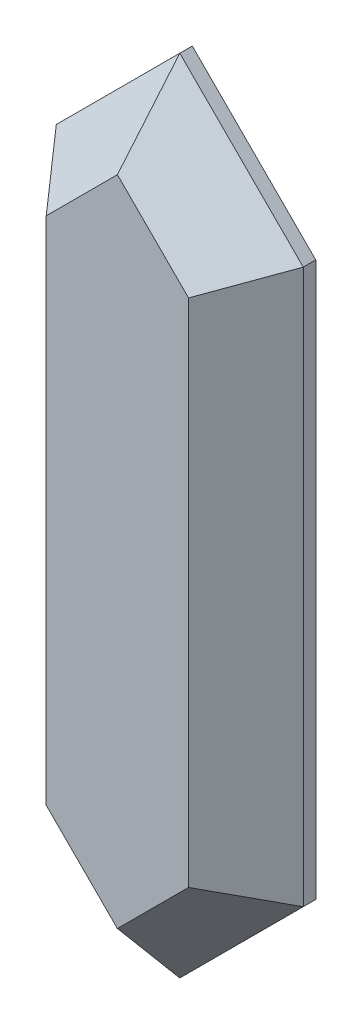
from build123d import *

# Parameters (mm, degrees)
EXTRUDE_1_DEPTH     = 2
EXTRUDE_2_DEPTH     = 10
EXTRUDE_2_TAPER     = 40
CUT_EXTRUDE_1_DEPTH = 2
CUT_EXTRUDE_2_DEPTH = 7
CUT_EXTRUDE_2_DRAFT = -40
EXTRUDE_4_DEPTH     = 0.7
EXTRUDE_4_TAPER     = 45


with BuildPart() as part:
    # Skizze1 → Бобышка-Вытянуть1 (new body)
    with BuildSketch(Plane.XY):
        Polygon((-19.798989873, 44.3), (0, 64.098989873), (19.798989873, 44.3), (19.798989873, -44.5), (0, -64.298989873), (-19.798989873, -44.5), align=None)
    extrude(amount=EXTRUDE_1_DEPTH)

    # Эскиз1 → Бобышка-Вытянуть2 (add)
    with BuildSketch(Plane.XY.offset(2)):
        Polygon((-19.798989873, 44.3), (-19.798989873, -44.5), (0, -64.298989873), (19.798989873, -44.5), (19.798989873, 44.3), (0, 64.098989873), align=None)
    extrude(amount=EXTRUDE_2_DEPTH, taper=EXTRUDE_2_TAPER)

    # Эскиз2 → Вырез-Вытянуть1 (cut)
    with BuildSketch(Plane(origin=(0, 0, 0), x_dir=(-1, 0, 0), z_dir=(0, 0, -1))):
        Polygon((-17.998989873, 43.554415588), (0, 61.553405461), (17.998989873, 43.554415588), (17.998989873, -43.754415588), (0, -61.753405461), (-17.998989873, -43.754415588), align=None)
    extrude(amount=-CUT_EXTRUDE_1_DEPTH, mode=Mode.SUBTRACT)


with BuildPart() as cut_extrude_2_tool:
    # Эскиз3 → Вырез-Вытянуть2 (with draft: the straight prism first)
    with BuildSketch(Plane(origin=(0, 0, 2), x_dir=(-1, 0, 0), z_dir=(0, 0, -1))):
        Polygon((-17.998989873, 43.554415588), (-17.998989873, -43.754415588), (0, -61.753405461), (17.998989873, -43.754415588), (17.998989873, 43.554415588), (0, 61.553405461), align=None)
    extrude(amount=-CUT_EXTRUDE_2_DEPTH)
    # Вырез-Вытянуть2: the draft: its side faces are tilted about the plane it starts from
    cut_extrude_2_sides = [cut_extrude_2_tool.faces().sort_by_distance(p)[0] for p in [
        (17.998989873, -0.1, 5.5),
        (8.999494937, -52.753910524, 5.5),
        (-8.999494937, -52.753910524, 5.5),
        (-17.998989873, -0.1, 5.5),
        (-8.999494937, 52.553910524, 5.5),
        (8.999494937, 52.553910524, 5.5),
    ]]
    draft(cut_extrude_2_sides, Plane(origin=(0, 0, 2), x_dir=(-1, 0, 0), z_dir=(0, 0, -1)), CUT_EXTRUDE_2_DRAFT)


with BuildPart() as part_1:
    add(part.part)

    # Вырез-Вытянуть2: cut by cut_extrude_2_tool
    add(cut_extrude_2_tool.part, mode=Mode.SUBTRACT)

    # Эскиз4 → Бобышка-Вытянуть4 (add)
    with BuildSketch(Plane(origin=(0, 0, 9), x_dir=(-1, 0, 0), z_dir=(0, 0, -1))):
        Polygon((-0.662531934, 48.870219551), (-1.749476442, 49.468949375), (-2.811463933, 48.826992731), (-2.786506916, 47.586306263), (-1.699562408, 46.987576439), (-0.637574917, 47.629533083), align=None)
        Polygon((2.787468066, 48.870219551), (1.700523558, 49.468949375), (0.638536067, 48.826992731), (0.663493084, 47.586306263), (1.750437592, 46.987576439), (2.812425083, 47.629533083), align=None)
        Polygon((-4.112531934, 44.870219551), (-5.199476442, 45.468949375), (-6.261463933, 44.826992731), (-6.236506916, 43.586306263), (-5.149562408, 42.987576439), (-4.087574917, 43.629533083), align=None)
        Polygon((-0.662531934, 44.870219551), (-1.749476442, 45.468949375), (-2.811463933, 44.826992731), (-2.786506916, 43.586306263), (-1.699562408, 42.987576439), (-0.637574917, 43.629533083), align=None)
        Polygon((2.787468066, 44.870219551), (1.700523558, 45.468949375), (0.638536067, 44.826992731), (0.663493084, 43.586306263), (1.750437592, 42.987576439), (2.812425083, 43.629533083), align=None)
        Polygon((6.237468066, 44.870219551), (5.150523558, 45.468949375), (4.088536067, 44.826992731), (4.113493084, 43.586306263), (5.200437592, 42.987576439), (6.262425083, 43.629533083), align=None)
        Polygon((-4.112531934, 40.870219551), (-5.199476442, 41.468949375), (-6.261463933, 40.826992731), (-6.236506916, 39.586306263), (-5.149562408, 38.987576439), (-4.087574917, 39.629533083), align=None)
        Polygon((-0.662531934, 40.870219551), (-1.749476442, 41.468949375), (-2.811463933, 40.826992731), (-2.786506916, 39.586306263), (-1.699562408, 38.987576439), (-0.637574917, 39.629533083), align=None)
        Polygon((2.787468066, 40.870219551), (1.700523558, 41.468949375), (0.638536067, 40.826992731), (0.663493084, 39.586306263), (1.750437592, 38.987576439), (2.812425083, 39.629533083), align=None)
        Polygon((6.237468066, 40.870219551), (5.150523558, 41.468949375), (4.088536067, 40.826992731), (4.113493084, 39.586306263), (5.200437592, 38.987576439), (6.262425083, 39.629533083), align=None)
        Polygon((9.687468066, 40.870219551), (8.600523558, 41.468949375), (7.538536067, 40.826992731), (7.563493084, 39.586306263), (8.650437592, 38.987576439), (9.712425083, 39.629533083), align=None)
        Polygon((-4.112531934, 36.870219551), (-5.199476442, 37.468949375), (-6.261463933, 36.826992731), (-6.236506916, 35.586306263), (-5.149562408, 34.987576439), (-4.087574917, 35.629533083), align=None)
        Polygon((-0.662531934, 36.870219551), (-1.749476442, 37.468949375), (-2.811463933, 36.826992731), (-2.786506916, 35.586306263), (-1.699562408, 34.987576439), (-0.637574917, 35.629533083), align=None)
        Polygon((2.787468066, 36.870219551), (1.700523558, 37.468949375), (0.638536067, 36.826992731), (0.663493084, 35.586306263), (1.750437592, 34.987576439), (2.812425083, 35.629533083), align=None)
        Polygon((6.237468066, 36.870219551), (5.150523558, 37.468949375), (4.088536067, 36.826992731), (4.113493084, 35.586306263), (5.200437592, 34.987576439), (6.262425083, 35.629533083), align=None)
        Polygon((9.687468066, 36.870219551), (8.600523558, 37.468949375), (7.538536067, 36.826992731), (7.563493084, 35.586306263), (8.650437592, 34.987576439), (9.712425083, 35.629533083), align=None)
        Polygon((-4.112531934, 32.870219551), (-5.199476442, 33.468949375), (-6.261463933, 32.826992731), (-6.236506916, 31.586306263), (-5.149562408, 30.987576439), (-4.087574917, 31.629533083), align=None)
        Polygon((-0.662531934, 32.870219551), (-1.749476442, 33.468949375), (-2.811463933, 32.826992731), (-2.786506916, 31.586306263), (-1.699562408, 30.987576439), (-0.637574917, 31.629533083), align=None)
        Polygon((2.787468066, 32.870219551), (1.700523558, 33.468949375), (0.638536067, 32.826992731), (0.663493084, 31.586306263), (1.750437592, 30.987576439), (2.812425083, 31.629533083), align=None)
        Polygon((6.237468066, 32.870219551), (5.150523558, 33.468949375), (4.088536067, 32.826992731), (4.113493084, 31.586306263), (5.200437592, 30.987576439), (6.262425083, 31.629533083), align=None)
        Polygon((9.687468066, 32.870219551), (8.600523558, 33.468949375), (7.538536067, 32.826992731), (7.563493084, 31.586306263), (8.650437592, 30.987576439), (9.712425083, 31.629533083), align=None)
        Polygon((-4.112531934, 28.870219551), (-5.199476442, 29.468949375), (-6.261463933, 28.826992731), (-6.236506916, 27.586306263), (-5.149562408, 26.987576439), (-4.087574917, 27.629533083), align=None)
        Polygon((-0.662531934, 28.870219551), (-1.749476442, 29.468949375), (-2.811463933, 28.826992731), (-2.786506916, 27.586306263), (-1.699562408, 26.987576439), (-0.637574917, 27.629533083), align=None)
        Polygon((2.787468066, 28.870219551), (1.700523558, 29.468949375), (0.638536067, 28.826992731), (0.663493084, 27.586306263), (1.750437592, 26.987576439), (2.812425083, 27.629533083), align=None)
        Polygon((6.237468066, 28.870219551), (5.150523558, 29.468949375), (4.088536067, 28.826992731), (4.113493084, 27.586306263), (5.200437592, 26.987576439), (6.262425083, 27.629533083), align=None)
        Polygon((9.687468066, 28.870219551), (8.600523558, 29.468949375), (7.538536067, 28.826992731), (7.563493084, 27.586306263), (8.650437592, 26.987576439), (9.712425083, 27.629533083), align=None)
        Polygon((-4.112531934, 24.870219551), (-5.199476442, 25.468949375), (-6.261463933, 24.826992731), (-6.236506916, 23.586306263), (-5.149562408, 22.987576439), (-4.087574917, 23.629533083), align=None)
        Polygon((-0.662531934, 24.870219551), (-1.749476442, 25.468949375), (-2.811463933, 24.826992731), (-2.786506916, 23.586306263), (-1.699562408, 22.987576439), (-0.637574917, 23.629533083), align=None)
        Polygon((2.787468066, 24.870219551), (1.700523558, 25.468949375), (0.638536067, 24.826992731), (0.663493084, 23.586306263), (1.750437592, 22.987576439), (2.812425083, 23.629533083), align=None)
        Polygon((6.237468066, 24.870219551), (5.150523558, 25.468949375), (4.088536067, 24.826992731), (4.113493084, 23.586306263), (5.200437592, 22.987576439), (6.262425083, 23.629533083), align=None)
        Polygon((9.687468066, 24.870219551), (8.600523558, 25.468949375), (7.538536067, 24.826992731), (7.563493084, 23.586306263), (8.650437592, 22.987576439), (9.712425083, 23.629533083), align=None)
        Polygon((-4.112531934, 20.870219551), (-5.199476442, 21.468949375), (-6.261463933, 20.826992731), (-6.236506916, 19.586306263), (-5.149562408, 18.987576439), (-4.087574917, 19.629533083), align=None)
        Polygon((-0.662531934, 20.870219551), (-1.749476442, 21.468949375), (-2.811463933, 20.826992731), (-2.786506916, 19.586306263), (-1.699562408, 18.987576439), (-0.637574917, 19.629533083), align=None)
        Polygon((2.787468066, 20.870219551), (1.700523558, 21.468949375), (0.638536067, 20.826992731), (0.663493084, 19.586306263), (1.750437592, 18.987576439), (2.812425083, 19.629533083), align=None)
        Polygon((6.237468066, 20.870219551), (5.150523558, 21.468949375), (4.088536067, 20.826992731), (4.113493084, 19.586306263), (5.200437592, 18.987576439), (6.262425083, 19.629533083), align=None)
        Polygon((9.687468066, 20.870219551), (8.600523558, 21.468949375), (7.538536067, 20.826992731), (7.563493084, 19.586306263), (8.650437592, 18.987576439), (9.712425083, 19.629533083), align=None)
        Polygon((-4.112531934, 16.870219551), (-5.199476442, 17.468949375), (-6.261463933, 16.826992731), (-6.236506916, 15.586306263), (-5.149562408, 14.987576439), (-4.087574917, 15.629533083), align=None)
        Polygon((-0.662531934, 16.870219551), (-1.749476442, 17.468949375), (-2.811463933, 16.826992731), (-2.786506916, 15.586306263), (-1.699562408, 14.987576439), (-0.637574917, 15.629533083), align=None)
        Polygon((2.787468066, 16.870219551), (1.700523558, 17.468949375), (0.638536067, 16.826992731), (0.663493084, 15.586306263), (1.750437592, 14.987576439), (2.812425083, 15.629533083), align=None)
        Polygon((6.237468066, 16.870219551), (5.150523558, 17.468949375), (4.088536067, 16.826992731), (4.113493084, 15.586306263), (5.200437592, 14.987576439), (6.262425083, 15.629533083), align=None)
        Polygon((9.687468066, 16.870219551), (8.600523558, 17.468949375), (7.538536067, 16.826992731), (7.563493084, 15.586306263), (8.650437592, 14.987576439), (9.712425083, 15.629533083), align=None)
        Polygon((-4.112531934, 12.870219551), (-5.199476442, 13.468949375), (-6.261463933, 12.826992731), (-6.236506916, 11.586306263), (-5.149562408, 10.987576439), (-4.087574917, 11.629533083), align=None)
        Polygon((-0.662531934, 12.870219551), (-1.749476442, 13.468949375), (-2.811463933, 12.826992731), (-2.786506916, 11.586306263), (-1.699562408, 10.987576439), (-0.637574917, 11.629533083), align=None)
        Polygon((2.787468066, 12.870219551), (1.700523558, 13.468949375), (0.638536067, 12.826992731), (0.663493084, 11.586306263), (1.750437592, 10.987576439), (2.812425083, 11.629533083), align=None)
        Polygon((6.237468066, 12.870219551), (5.150523558, 13.468949375), (4.088536067, 12.826992731), (4.113493084, 11.586306263), (5.200437592, 10.987576439), (6.262425083, 11.629533083), align=None)
        Polygon((9.687468066, 12.870219551), (8.600523558, 13.468949375), (7.538536067, 12.826992731), (7.563493084, 11.586306263), (8.650437592, 10.987576439), (9.712425083, 11.629533083), align=None)
        Polygon((-4.112531934, 8.870219551), (-5.199476442, 9.468949375), (-6.261463933, 8.826992731), (-6.236506916, 7.586306263), (-5.149562408, 6.987576439), (-4.087574917, 7.629533083), align=None)
        Polygon((-0.662531934, 8.870219551), (-1.749476442, 9.468949375), (-2.811463933, 8.826992731), (-2.786506916, 7.586306263), (-1.699562408, 6.987576439), (-0.637574917, 7.629533083), align=None)
        Polygon((2.787468066, 8.870219551), (1.700523558, 9.468949375), (0.638536067, 8.826992731), (0.663493084, 7.586306263), (1.750437592, 6.987576439), (2.812425083, 7.629533083), align=None)
        Polygon((6.237468066, 8.870219551), (5.150523558, 9.468949375), (4.088536067, 8.826992731), (4.113493084, 7.586306263), (5.200437592, 6.987576439), (6.262425083, 7.629533083), align=None)
        Polygon((9.687468066, 8.870219551), (8.600523558, 9.468949375), (7.538536067, 8.826992731), (7.563493084, 7.586306263), (8.650437592, 6.987576439), (9.712425083, 7.629533083), align=None)
        Polygon((-4.112531934, 4.870219551), (-5.199476442, 5.468949375), (-6.261463933, 4.826992731), (-6.236506916, 3.586306263), (-5.149562408, 2.987576439), (-4.087574917, 3.629533083), align=None)
        Polygon((-0.662531934, 4.870219551), (-1.749476442, 5.468949375), (-2.811463933, 4.826992731), (-2.786506916, 3.586306263), (-1.699562408, 2.987576439), (-0.637574917, 3.629533083), align=None)
        Polygon((2.787468066, 4.870219551), (1.700523558, 5.468949375), (0.638536067, 4.826992731), (0.663493084, 3.586306263), (1.750437592, 2.987576439), (2.812425083, 3.629533083), align=None)
        Polygon((6.237468066, 4.870219551), (5.150523558, 5.468949375), (4.088536067, 4.826992731), (4.113493084, 3.586306263), (5.200437592, 2.987576439), (6.262425083, 3.629533083), align=None)
        Polygon((9.687468066, 4.870219551), (8.600523558, 5.468949375), (7.538536067, 4.826992731), (7.563493084, 3.586306263), (8.650437592, 2.987576439), (9.712425083, 3.629533083), align=None)
        Polygon((-4.112531934, 0.870219551), (-5.199476442, 1.468949375), (-6.261463933, 0.826992731), (-6.236506916, -0.413693737), (-5.149562408, -1.012423561), (-4.087574917, -0.370466917), align=None)
        Polygon((-0.662531934, 0.870219551), (-1.749476442, 1.468949375), (-2.811463933, 0.826992731), (-2.786506916, -0.413693737), (-1.699562408, -1.012423561), (-0.637574917, -0.370466917), align=None)
        Polygon((2.787468066, 0.870219551), (1.700523558, 1.468949375), (0.638536067, 0.826992731), (0.663493084, -0.413693737), (1.750437592, -1.012423561), (2.812425083, -0.370466917), align=None)
        Polygon((6.237468066, 0.870219551), (5.150523558, 1.468949375), (4.088536067, 0.826992731), (4.113493084, -0.413693737), (5.200437592, -1.012423561), (6.262425083, -0.370466917), align=None)
        Polygon((9.687468066, 0.870219551), (8.600523558, 1.468949375), (7.538536067, 0.826992731), (7.563493084, -0.413693737), (8.650437592, -1.012423561), (9.712425083, -0.370466917), align=None)
        Polygon((-4.112531934, -3.129780449), (-5.199476442, -2.531050625), (-6.261463933, -3.173007269), (-6.236506916, -4.413693737), (-5.149562408, -5.012423561), (-4.087574917, -4.370466917), align=None)
        Polygon((-0.662531934, -3.129780449), (-1.749476442, -2.531050625), (-2.811463933, -3.173007269), (-2.786506916, -4.413693737), (-1.699562408, -5.012423561), (-0.637574917, -4.370466917), align=None)
        Polygon((2.787468066, -3.129780449), (1.700523558, -2.531050625), (0.638536067, -3.173007269), (0.663493084, -4.413693737), (1.750437592, -5.012423561), (2.812425083, -4.370466917), align=None)
        Polygon((6.237468066, -3.129780449), (5.150523558, -2.531050625), (4.088536067, -3.173007269), (4.113493084, -4.413693737), (5.200437592, -5.012423561), (6.262425083, -4.370466917), align=None)
        Polygon((9.687468066, -3.129780449), (8.600523558, -2.531050625), (7.538536067, -3.173007269), (7.563493084, -4.413693737), (8.650437592, -5.012423561), (9.712425083, -4.370466917), align=None)
        Polygon((-4.112531934, -7.129780449), (-5.199476442, -6.531050625), (-6.261463933, -7.173007269), (-6.236506916, -8.413693737), (-5.149562408, -9.012423561), (-4.087574917, -8.370466917), align=None)
        Polygon((-0.662531934, -7.129780449), (-1.749476442, -6.531050625), (-2.811463933, -7.173007269), (-2.786506916, -8.413693737), (-1.699562408, -9.012423561), (-0.637574917, -8.370466917), align=None)
        Polygon((2.787468066, -7.129780449), (1.700523558, -6.531050625), (0.638536067, -7.173007269), (0.663493084, -8.413693737), (1.750437592, -9.012423561), (2.812425083, -8.370466917), align=None)
        Polygon((6.237468066, -7.129780449), (5.150523558, -6.531050625), (4.088536067, -7.173007269), (4.113493084, -8.413693737), (5.200437592, -9.012423561), (6.262425083, -8.370466917), align=None)
        Polygon((9.687468066, -7.129780449), (8.600523558, -6.531050625), (7.538536067, -7.173007269), (7.563493084, -8.413693737), (8.650437592, -9.012423561), (9.712425083, -8.370466917), align=None)
        Polygon((-4.112531934, -11.129780449), (-5.199476442, -10.531050625), (-6.261463933, -11.173007269), (-6.236506916, -12.413693737), (-5.149562408, -13.012423561), (-4.087574917, -12.370466917), align=None)
        Polygon((-0.662531934, -11.129780449), (-1.749476442, -10.531050625), (-2.811463933, -11.173007269), (-2.786506916, -12.413693737), (-1.699562408, -13.012423561), (-0.637574917, -12.370466917), align=None)
        Polygon((2.787468066, -11.129780449), (1.700523558, -10.531050625), (0.638536067, -11.173007269), (0.663493084, -12.413693737), (1.750437592, -13.012423561), (2.812425083, -12.370466917), align=None)
        Polygon((6.237468066, -11.129780449), (5.150523558, -10.531050625), (4.088536067, -11.173007269), (4.113493084, -12.413693737), (5.200437592, -13.012423561), (6.262425083, -12.370466917), align=None)
        Polygon((9.687468066, -11.129780449), (8.600523558, -10.531050625), (7.538536067, -11.173007269), (7.563493084, -12.413693737), (8.650437592, -13.012423561), (9.712425083, -12.370466917), align=None)
        Polygon((-4.112531934, -15.129780449), (-5.199476442, -14.531050625), (-6.261463933, -15.173007269), (-6.236506916, -16.413693737), (-5.149562408, -17.012423561), (-4.087574917, -16.370466917), align=None)
        Polygon((-0.662531934, -15.129780449), (-1.749476442, -14.531050625), (-2.811463933, -15.173007269), (-2.786506916, -16.413693737), (-1.699562408, -17.012423561), (-0.637574917, -16.370466917), align=None)
        Polygon((2.787468066, -15.129780449), (1.700523558, -14.531050625), (0.638536067, -15.173007269), (0.663493084, -16.413693737), (1.750437592, -17.012423561), (2.812425083, -16.370466917), align=None)
        Polygon((6.237468066, -15.129780449), (5.150523558, -14.531050625), (4.088536067, -15.173007269), (4.113493084, -16.413693737), (5.200437592, -17.012423561), (6.262425083, -16.370466917), align=None)
        Polygon((9.687468066, -15.129780449), (8.600523558, -14.531050625), (7.538536067, -15.173007269), (7.563493084, -16.413693737), (8.650437592, -17.012423561), (9.712425083, -16.370466917), align=None)
        Polygon((-4.112531934, -19.129780449), (-5.199476442, -18.531050625), (-6.261463933, -19.173007269), (-6.236506916, -20.413693737), (-5.149562408, -21.012423561), (-4.087574917, -20.370466917), align=None)
        Polygon((-0.662531934, -19.129780449), (-1.749476442, -18.531050625), (-2.811463933, -19.173007269), (-2.786506916, -20.413693737), (-1.699562408, -21.012423561), (-0.637574917, -20.370466917), align=None)
        Polygon((2.787468066, -19.129780449), (1.700523558, -18.531050625), (0.638536067, -19.173007269), (0.663493084, -20.413693737), (1.750437592, -21.012423561), (2.812425083, -20.370466917), align=None)
        Polygon((6.237468066, -19.129780449), (5.150523558, -18.531050625), (4.088536067, -19.173007269), (4.113493084, -20.413693737), (5.200437592, -21.012423561), (6.262425083, -20.370466917), align=None)
        Polygon((9.687468066, -19.129780449), (8.600523558, -18.531050625), (7.538536067, -19.173007269), (7.563493084, -20.413693737), (8.650437592, -21.012423561), (9.712425083, -20.370466917), align=None)
        Polygon((-4.112531934, -23.129780449), (-5.199476442, -22.531050625), (-6.261463933, -23.173007269), (-6.236506916, -24.413693737), (-5.149562408, -25.012423561), (-4.087574917, -24.370466917), align=None)
        Polygon((-0.662531934, -23.129780449), (-1.749476442, -22.531050625), (-2.811463933, -23.173007269), (-2.786506916, -24.413693737), (-1.699562408, -25.012423561), (-0.637574917, -24.370466917), align=None)
        Polygon((2.787468066, -23.129780449), (1.700523558, -22.531050625), (0.638536067, -23.173007269), (0.663493084, -24.413693737), (1.750437592, -25.012423561), (2.812425083, -24.370466917), align=None)
        Polygon((6.237468066, -23.129780449), (5.150523558, -22.531050625), (4.088536067, -23.173007269), (4.113493084, -24.413693737), (5.200437592, -25.012423561), (6.262425083, -24.370466917), align=None)
        Polygon((9.687468066, -23.129780449), (8.600523558, -22.531050625), (7.538536067, -23.173007269), (7.563493084, -24.413693737), (8.650437592, -25.012423561), (9.712425083, -24.370466917), align=None)
        Polygon((-4.112531934, -27.129780449), (-5.199476442, -26.531050625), (-6.261463933, -27.173007269), (-6.236506916, -28.413693737), (-5.149562408, -29.012423561), (-4.087574917, -28.370466917), align=None)
        Polygon((-0.662531934, -27.129780449), (-1.749476442, -26.531050625), (-2.811463933, -27.173007269), (-2.786506916, -28.413693737), (-1.699562408, -29.012423561), (-0.637574917, -28.370466917), align=None)
        Polygon((2.787468066, -27.129780449), (1.700523558, -26.531050625), (0.638536067, -27.173007269), (0.663493084, -28.413693737), (1.750437592, -29.012423561), (2.812425083, -28.370466917), align=None)
        Polygon((6.237468066, -27.129780449), (5.150523558, -26.531050625), (4.088536067, -27.173007269), (4.113493084, -28.413693737), (5.200437592, -29.012423561), (6.262425083, -28.370466917), align=None)
        Polygon((9.687468066, -27.129780449), (8.600523558, -26.531050625), (7.538536067, -27.173007269), (7.563493084, -28.413693737), (8.650437592, -29.012423561), (9.712425083, -28.370466917), align=None)
        Polygon((-4.112531934, -31.129780449), (-5.199476442, -30.531050625), (-6.261463933, -31.173007269), (-6.236506916, -32.413693737), (-5.149562408, -33.012423561), (-4.087574917, -32.370466917), align=None)
        Polygon((-0.662531934, -31.129780449), (-1.749476442, -30.531050625), (-2.811463933, -31.173007269), (-2.786506916, -32.413693737), (-1.699562408, -33.012423561), (-0.637574917, -32.370466917), align=None)
        Polygon((2.787468066, -31.129780449), (1.700523558, -30.531050625), (0.638536067, -31.173007269), (0.663493084, -32.413693737), (1.750437592, -33.012423561), (2.812425083, -32.370466917), align=None)
        Polygon((6.237468066, -31.129780449), (5.150523558, -30.531050625), (4.088536067, -31.173007269), (4.113493084, -32.413693737), (5.200437592, -33.012423561), (6.262425083, -32.370466917), align=None)
        Polygon((9.687468066, -31.129780449), (8.600523558, -30.531050625), (7.538536067, -31.173007269), (7.563493084, -32.413693737), (8.650437592, -33.012423561), (9.712425083, -32.370466917), align=None)
        Polygon((-4.112531934, -35.129780449), (-5.199476442, -34.531050625), (-6.261463933, -35.173007269), (-6.236506916, -36.413693737), (-5.149562408, -37.012423561), (-4.087574917, -36.370466917), align=None)
        Polygon((-0.662531934, -35.129780449), (-1.749476442, -34.531050625), (-2.811463933, -35.173007269), (-2.786506916, -36.413693737), (-1.699562408, -37.012423561), (-0.637574917, -36.370466917), align=None)
        Polygon((2.787468066, -35.129780449), (1.700523558, -34.531050625), (0.638536067, -35.173007269), (0.663493084, -36.413693737), (1.750437592, -37.012423561), (2.812425083, -36.370466917), align=None)
        Polygon((6.237468066, -35.129780449), (5.150523558, -34.531050625), (4.088536067, -35.173007269), (4.113493084, -36.413693737), (5.200437592, -37.012423561), (6.262425083, -36.370466917), align=None)
        Polygon((9.687468066, -35.129780449), (8.600523558, -34.531050625), (7.538536067, -35.173007269), (7.563493084, -36.413693737), (8.650437592, -37.012423561), (9.712425083, -36.370466917), align=None)
        Polygon((-4.112531934, -39.129780449), (-5.199476442, -38.531050625), (-6.261463933, -39.173007269), (-6.236506916, -40.413693737), (-5.149562408, -41.012423561), (-4.087574917, -40.370466917), align=None)
        Polygon((-0.662531934, -39.129780449), (-1.749476442, -38.531050625), (-2.811463933, -39.173007269), (-2.786506916, -40.413693737), (-1.699562408, -41.012423561), (-0.637574917, -40.370466917), align=None)
        Polygon((2.787468066, -39.129780449), (1.700523558, -38.531050625), (0.638536067, -39.173007269), (0.663493084, -40.413693737), (1.750437592, -41.012423561), (2.812425083, -40.370466917), align=None)
        Polygon((6.237468066, -39.129780449), (5.150523558, -38.531050625), (4.088536067, -39.173007269), (4.113493084, -40.413693737), (5.200437592, -41.012423561), (6.262425083, -40.370466917), align=None)
        Polygon((9.687468066, -39.129780449), (8.600523558, -38.531050625), (7.538536067, -39.173007269), (7.563493084, -40.413693737), (8.650437592, -41.012423561), (9.712425083, -40.370466917), align=None)
        Polygon((-4.112531934, -43.129780449), (-5.199476442, -42.531050625), (-6.261463933, -43.173007269), (-6.236506916, -44.413693737), (-5.149562408, -45.012423561), (-4.087574917, -44.370466917), align=None)
        Polygon((-0.662531934, -43.129780449), (-1.749476442, -42.531050625), (-2.811463933, -43.173007269), (-2.786506916, -44.413693737), (-1.699562408, -45.012423561), (-0.637574917, -44.370466917), align=None)
        Polygon((2.787468066, -43.129780449), (1.700523558, -42.531050625), (0.638536067, -43.173007269), (0.663493084, -44.413693737), (1.750437592, -45.012423561), (2.812425083, -44.370466917), align=None)
        Polygon((6.237468066, -43.129780449), (5.150523558, -42.531050625), (4.088536067, -43.173007269), (4.113493084, -44.413693737), (5.200437592, -45.012423561), (6.262425083, -44.370466917), align=None)
        Polygon((-0.662531934, -47.129780449), (-1.749476442, -46.531050625), (-2.811463933, -47.173007269), (-2.786506916, -48.413693737), (-1.699562408, -49.012423561), (-0.637574917, -48.370466917), align=None)
        Polygon((2.787468066, -47.129780449), (1.700523558, -46.531050625), (0.638536067, -47.173007269), (0.663493084, -48.413693737), (1.750437592, -49.012423561), (2.812425083, -48.370466917), align=None)
        Polygon((-7.562531934, 40.870219551), (-8.649476442, 41.468949375), (-9.711463933, 40.826992731), (-9.686506916, 39.586306263), (-8.599562408, 38.987576439), (-7.537574917, 39.629533083), align=None)
        Polygon((-7.562531934, 36.870219551), (-8.649476442, 37.468949375), (-9.711463933, 36.826992731), (-9.686506916, 35.586306263), (-8.599562408, 34.987576439), (-7.537574917, 35.629533083), align=None)
        Polygon((-7.562531934, 32.870219551), (-8.649476442, 33.468949375), (-9.711463933, 32.826992731), (-9.686506916, 31.586306263), (-8.599562408, 30.987576439), (-7.537574917, 31.629533083), align=None)
        Polygon((-7.562531934, 28.870219551), (-8.649476442, 29.468949375), (-9.711463933, 28.826992731), (-9.686506916, 27.586306263), (-8.599562408, 26.987576439), (-7.537574917, 27.629533083), align=None)
        Polygon((-7.562531934, 24.870219551), (-8.649476442, 25.468949375), (-9.711463933, 24.826992731), (-9.686506916, 23.586306263), (-8.599562408, 22.987576439), (-7.537574917, 23.629533083), align=None)
        Polygon((-7.562531934, 20.870219551), (-8.649476442, 21.468949375), (-9.711463933, 20.826992731), (-9.686506916, 19.586306263), (-8.599562408, 18.987576439), (-7.537574917, 19.629533083), align=None)
        Polygon((-7.562531934, 16.870219551), (-8.649476442, 17.468949375), (-9.711463933, 16.826992731), (-9.686506916, 15.586306263), (-8.599562408, 14.987576439), (-7.537574917, 15.629533083), align=None)
        Polygon((-7.562531934, 12.870219551), (-8.649476442, 13.468949375), (-9.711463933, 12.826992731), (-9.686506916, 11.586306263), (-8.599562408, 10.987576439), (-7.537574917, 11.629533083), align=None)
        Polygon((-7.562531934, 8.870219551), (-8.649476442, 9.468949375), (-9.711463933, 8.826992731), (-9.686506916, 7.586306263), (-8.599562408, 6.987576439), (-7.537574917, 7.629533083), align=None)
        Polygon((-7.562531934, 4.870219551), (-8.649476442, 5.468949375), (-9.711463933, 4.826992731), (-9.686506916, 3.586306263), (-8.599562408, 2.987576439), (-7.537574917, 3.629533083), align=None)
        Polygon((-7.562531934, 0.870219551), (-8.649476442, 1.468949375), (-9.711463933, 0.826992731), (-9.686506916, -0.413693737), (-8.599562408, -1.012423561), (-7.537574917, -0.370466917), align=None)
        Polygon((-7.562531934, -3.129780449), (-8.649476442, -2.531050625), (-9.711463933, -3.173007269), (-9.686506916, -4.413693737), (-8.599562408, -5.012423561), (-7.537574917, -4.370466917), align=None)
        Polygon((-7.562531934, -7.129780449), (-8.649476442, -6.531050625), (-9.711463933, -7.173007269), (-9.686506916, -8.413693737), (-8.599562408, -9.012423561), (-7.537574917, -8.370466917), align=None)
        Polygon((-7.562531934, -11.129780449), (-8.649476442, -10.531050625), (-9.711463933, -11.173007269), (-9.686506916, -12.413693737), (-8.599562408, -13.012423561), (-7.537574917, -12.370466917), align=None)
        Polygon((-7.562531934, -15.129780449), (-8.649476442, -14.531050625), (-9.711463933, -15.173007269), (-9.686506916, -16.413693737), (-8.599562408, -17.012423561), (-7.537574917, -16.370466917), align=None)
        Polygon((-7.562531934, -19.129780449), (-8.649476442, -18.531050625), (-9.711463933, -19.173007269), (-9.686506916, -20.413693737), (-8.599562408, -21.012423561), (-7.537574917, -20.370466917), align=None)
        Polygon((-7.562531934, -23.129780449), (-8.649476442, -22.531050625), (-9.711463933, -23.173007269), (-9.686506916, -24.413693737), (-8.599562408, -25.012423561), (-7.537574917, -24.370466917), align=None)
        Polygon((-7.562531934, -27.129780449), (-8.649476442, -26.531050625), (-9.711463933, -27.173007269), (-9.686506916, -28.413693737), (-8.599562408, -29.012423561), (-7.537574917, -28.370466917), align=None)
        Polygon((-7.562531934, -31.129780449), (-8.649476442, -30.531050625), (-9.711463933, -31.173007269), (-9.686506916, -32.413693737), (-8.599562408, -33.012423561), (-7.537574917, -32.370466917), align=None)
        Polygon((-7.562531934, -35.129780449), (-8.649476442, -34.531050625), (-9.711463933, -35.173007269), (-9.686506916, -36.413693737), (-8.599562408, -37.012423561), (-7.537574917, -36.370466917), align=None)
        Polygon((-7.562531934, -39.129780449), (-8.649476442, -38.531050625), (-9.711463933, -39.173007269), (-9.686506916, -40.413693737), (-8.599562408, -41.012423561), (-7.537574917, -40.370466917), align=None)
    extrude(amount=EXTRUDE_4_DEPTH, taper=EXTRUDE_4_TAPER)


solid = part_1.part
